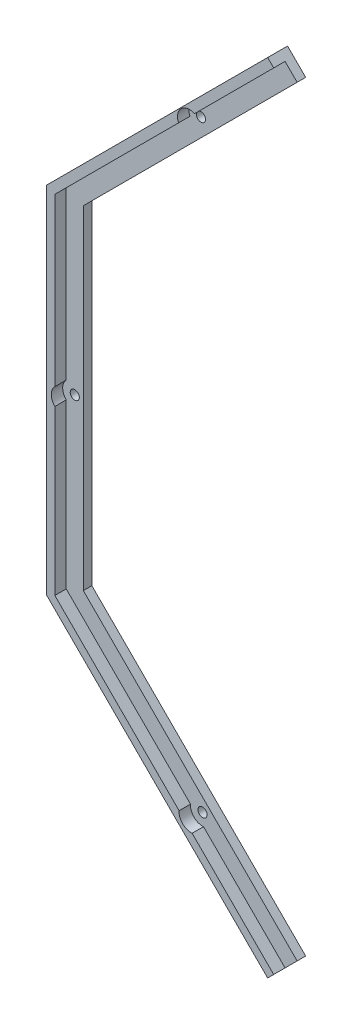
from build123d import *

# Parameters (mm, degrees)
SHEET_EXTRUSION_DEPTH           = 3
ESQUISSE_TROU_ROUE_DROITE_W     = 70
ESQUISSE_TROU_ROUE_DROITE_H     = 40
LEFTWHEEL_EXTRUSION_DEPTH       = 219.408952171
ESQUISSE20_W                    = 30
ESQUISSE20_H                    = 17
LEFTFREEWHEEL_HOLE_DEPTH        = 219.408952171
LEFTWHEEL_FIX_OUTLINE_R         = 2.5
LEFTWHEEL_FIX_DEPTH             = 3
BALL_EXTRUSION_OUTLINE_R        = 12
BALL_EXTRUSION_DEPTH            = 3
ARROUND_FIX_EXTRUSION_OUTLINE_R = 2.5
ARROUND_FIX_EXTRUSION_DEPTH     = 3
LEFT_PROFILE_HOLE_OUTLINE_R     = 2.5
LEFT_PROFILE_HOLE_DEPTH         = 3
LEFT_FIX_MECA_SKETCH_R          = 1.5
LEFT_FIX_MECA_EXTRUSION_DEPTH   = 219.408952171
LEFT_CODER_HOLES_SKETCH_R       = 1.5
LEFT_CODER_HOLES_DEPTH          = 219.408952171
BOTTOM_FIX_HOLES_SKETCH_R       = 1.5
RIGHT_FIX_MECA_HOLES_DEPTH      = 219.408952171
SKETCH1_R                       = 1.6
BOSS_EXTRUDE1_DEPTH             = 3
BOSS_EXTRUDE2_DEPTH             = 4
SKETCH2_W                       = 3
SKETCH2_H                       = 308.847763108
CUT_EXTRUDE1_DEPTH              = 269.911228609
SKETCH3_R                       = 4.25
CUT_EXTRUDE4_DEPTH              = 209.157310334


# Read off the part's stored shape, not the designer's step: LeftWheel-Fix, Ball-Extrusion, Arround-Fix-Extrusion, Left-Profile-Hole
with BuildPart() as part:
    # Sheet-Sketch → Sheet-Extrusion (new body)
    with BuildSketch(Plane.XY):
        Polygon((-62.5, 154.423881554), (62.5, 154.423881554), (65.5, 154.423881554), (65.5, 109.423881554), (39, 75), (20, 75), (20, -75), (39, -75), (65.5, -109.423881554), (65.5, -154.423881554), (62.5, -154.423881554), (-62.5, -154.423881554), (-154.423881554, -62.5), (-154.423881554, 62.5), align=None)
    extrude(amount=SHEET_EXTRUSION_DEPTH)

    # Esquisse Trou Roue Droite → LeftWheel-Extrusion (cut, through all)
    with BuildSketch(Plane.XY.offset(3)):
        with Locations((1.237734866, 107.423881554)):
            Rectangle(ESQUISSE_TROU_ROUE_DROITE_W, ESQUISSE_TROU_ROUE_DROITE_H)
    leftwheel_extrusion = extrude(amount=-LEFTWHEEL_EXTRUSION_DEPTH, mode=Mode.SUBTRACT)

    # Esquisse20 → LeftFreeWheel-Hole (cut, through all)
    with BuildSketch(Plane.XY.offset(3)):
        with Locations((1.402864765, 135.923881554)):
            Rectangle(ESQUISSE20_W, ESQUISSE20_H)
    leftfreewheel_hole = extrude(amount=-LEFTFREEWHEEL_HOLE_DEPTH, mode=Mode.SUBTRACT)

    # LeftWheel-Fix outline → LeftWheel-Fix (cut)
    with BuildSketch(Plane.XY):
        with Locations((0.388540939, 40)):
            Circle(LEFTWHEEL_FIX_OUTLINE_R)
    leftwheel_fix = extrude(amount=LEFTWHEEL_FIX_DEPTH, mode=Mode.SUBTRACT)

    # Ball-Extrusion outline → Ball-Extrusion (cut)
    with BuildSketch(Plane.XY):
        with Locations((-114.423881554, 0)):
            Circle(BALL_EXTRUSION_OUTLINE_R)
    extrude(amount=BALL_EXTRUSION_DEPTH, mode=Mode.SUBTRACT)

    # Arround-Fix-Extrusion outline → Arround-Fix-Extrusion (cut)
    with BuildSketch(Plane.XY):
        with Locations((60.248995228, 148.862139245)):
            Circle(ARROUND_FIX_EXTRUSION_OUTLINE_R)
        with Locations((-60.248995228, 148.862139245)):
            Circle(ARROUND_FIX_EXTRUSION_OUTLINE_R)
        with Locations((-148.862139245, 60.248995228)):
            Circle(ARROUND_FIX_EXTRUSION_OUTLINE_R)
    arround_fix_extrusion = extrude(amount=ARROUND_FIX_EXTRUSION_DEPTH, mode=Mode.SUBTRACT)

    # Left-Profile-Hole outline → Left-Profile-Hole (cut)
    with BuildSketch(Plane.XY):
        with Locations((-52.5, 144.423881554)):
            Circle(LEFT_PROFILE_HOLE_OUTLINE_R)
        with Locations((52.5, 144.423881554)):
            Circle(LEFT_PROFILE_HOLE_OUTLINE_R)
    left_profile_hole = extrude(amount=LEFT_PROFILE_HOLE_DEPTH, mode=Mode.SUBTRACT)

    # Left-Fix-Meca-Sketch → Left-Fix-Meca-Extrusion (cut, through all)
    with BuildSketch(Plane.XY.offset(3)):
        with Locations((27.801900038, 82.423881554)):
            Circle(LEFT_FIX_MECA_SKETCH_R)
        with Locations((58.5, 129.423881554)):
            Circle(LEFT_FIX_MECA_SKETCH_R)
    left_fix_meca_extrusion = extrude(amount=-LEFT_FIX_MECA_EXTRUSION_DEPTH, mode=Mode.SUBTRACT)

    # Left-Coder-Holes-Sketch → Left-Coder-Holes (cut, through all)
    with BuildSketch(Plane.XY.offset(3)):
        with Locations((-28.724826295, 131.423881554)):
            Circle(LEFT_CODER_HOLES_SKETCH_R)
        with Locations((31.275173705, 131.423881554)):
            Circle(LEFT_CODER_HOLES_SKETCH_R)
    left_coder_holes = extrude(amount=-LEFT_CODER_HOLES_DEPTH, mode=Mode.SUBTRACT)

    # Bottom-Fix-Holes-Sketch → Right-Fix-Meca-Holes (cut, through all)
    with BuildSketch(Plane.XY.offset(3)):
        with Locations((-104.353414534, 105.499399209)):
            Circle(BOTTOM_FIX_HOLES_SKETCH_R)
        with Locations((-85.741045982, 80.490778132)):
            Circle(BOTTOM_FIX_HOLES_SKETCH_R)
    right_fix_meca_holes = extrude(amount=-RIGHT_FIX_MECA_HOLES_DEPTH, mode=Mode.SUBTRACT)

    # Symetry-All-Pieces: LeftWheel-Extrusion, LeftFreeWheel-Hole, LeftWheel-Fix, Arround-Fix-Extrusion, Left-Profile-Hole, Left-Fix-Meca-Extrusion, Left-Coder-Holes, Right-Fix-Meca-Holes across plane
    add(leftwheel_extrusion.mirror(Plane.ZX), mode=Mode.SUBTRACT)
    add(leftfreewheel_hole.mirror(Plane.ZX), mode=Mode.SUBTRACT)
    add(leftwheel_fix.mirror(Plane.ZX), mode=Mode.SUBTRACT)
    add(arround_fix_extrusion.mirror(Plane.ZX), mode=Mode.SUBTRACT)
    add(left_profile_hole.mirror(Plane.ZX), mode=Mode.SUBTRACT)
    add(left_fix_meca_extrusion.mirror(Plane.ZX), mode=Mode.SUBTRACT)
    add(left_coder_holes.mirror(Plane.ZX), mode=Mode.SUBTRACT)
    add(right_fix_meca_holes.mirror(Plane.ZX), mode=Mode.SUBTRACT)

    # Sketch1 → Boss-Extrude1 (add)
    with BuildSketch(Plane.XY.offset(3)):
        Polygon((-76.142135624, 140.074639149), (-69.778174593, 133.710678119), (-144.923881554, 58.564971157), (-144.923881554, -58.564971157), (-69.778174593, -133.710678119), (-76.142135624, -140.074639149), (-153.923881554, -62.292893219), (-153.923881554, 62.292893219), align=None)
        with Locations((-147.923881554, -0.5)):
            Circle(SKETCH1_R, mode=Mode.SUBTRACT)
        with Locations(Location((-103.027804769, -105.05724202, 0), (0, 0, 138.844831023))):
            Circle(SKETCH1_R, mode=Mode.SUBTRACT)
        with Locations(Location((-103.577878734, 106.274935009, 0), (0, 0, 160.535415734))):
            Circle(SKETCH1_R, mode=Mode.SUBTRACT)
    extrude(amount=BOSS_EXTRUDE1_DEPTH)

    # Sketch4 → Boss-Extrude2 (add)
    with BuildSketch(Plane.XY.offset(6)):
        Polygon((-74.02081528, 137.953318806), (-76.142135624, 140.074639149), (-153.923881554, 62.292893219), (-153.923881554, -62.292893219), (-76.142135624, -140.074639149), (-74.02081528, -137.953318806), (-150.923881554, -61.050252532), (-150.923881554, 61.050252532), align=None)
    extrude(amount=BOSS_EXTRUDE2_DEPTH)

    # Sketch2 → Cut-Extrude1 (cut, through all)
    with BuildSketch(Plane.ZY.offset(154.423881554)):
        with Locations((1.5, 0)):
            Rectangle(SKETCH2_W, SKETCH2_H)
    extrude(amount=-CUT_EXTRUDE1_DEPTH, mode=Mode.SUBTRACT)

    # Sketch3 → Cut-Extrude4 (cut, through all)
    with BuildSketch(Plane.XY.offset(6)):
        with Locations((-147.923881554, -0.5)):
            Circle(SKETCH3_R)
        with Locations((-103.577878734, 106.274935009)):
            Circle(SKETCH3_R)
        with Locations((-103.027804769, -105.05724202)):
            Circle(SKETCH3_R)
    extrude(amount=CUT_EXTRUDE4_DEPTH, mode=Mode.SUBTRACT)


solid = part.part
